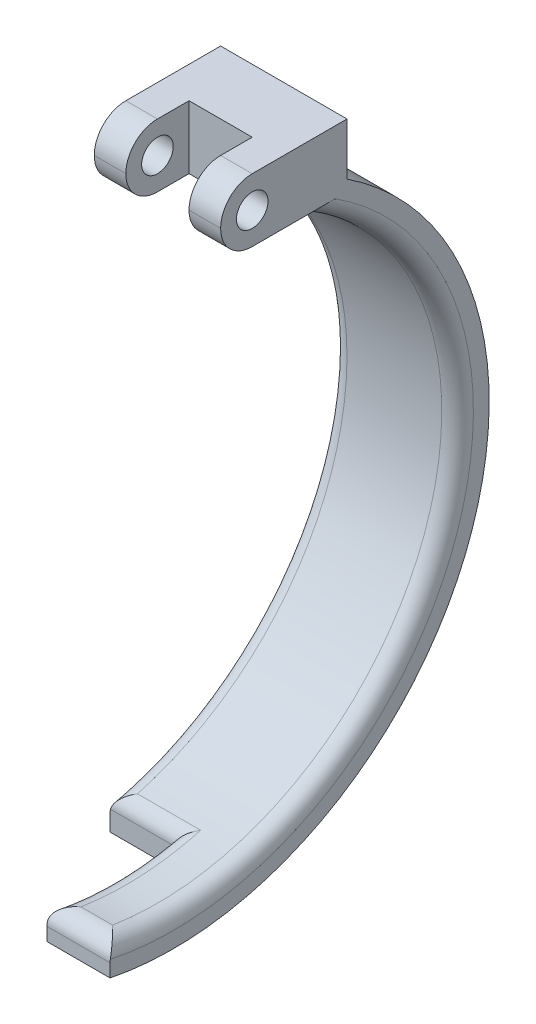
from build123d import *

# Parameters (mm, degrees)
SKETCH3_W               = 20
SKETCH3_H               = 10
BOSS_EXTRUDE2_DEPTH     = 20
CUT_EXTRUDE2_REACH      = 37.444
SKETCH4_W               = 10
SKETCH4_H               = 10
CUT_EXTRUDE3_DEPTH      = 33.882366095
CUT_EXTRUDE3_DEPTH_BACK = 33.882366095
SKETCH5_R               = 2.5
BOSS_EXTRUDE3_DEPTH     = 20
BOSS_EXTRUDE4_START     = -10
BOSS_EXTRUDE4_DEPTH     = 10
CUT_EXTRUDE4_DEPTH      = 10
FILLET1_R               = 5
FILLET2_R               = 2.5


with BuildPart() as part:
    # Sketch3 → Boss-Extrude2 (new body)
    with BuildSketch(Plane(origin=(0, 0, 0), x_dir=(0, 0, -1), z_dir=(1, 0, 0))):
        with Locations((17.5, 5)):
            Rectangle(SKETCH3_W, SKETCH3_H)
    extrude(amount=BOSS_EXTRUDE2_DEPTH)

    # Sketch4 → Cut-Extrude2 (cut, up to next)
    with BuildSketch(Plane(origin=(0, 10, 0), x_dir=(1, 0, 0), z_dir=(0, 1, 0)), mode=Mode.PRIVATE) as cut_extrude2_sk1:
        with Locations((10, 12.5)):
            Rectangle(SKETCH4_W, SKETCH4_H)
    cut_extrude2_tool1 = extrude(cut_extrude2_sk1.sketch, amount=-CUT_EXTRUDE2_REACH, mode=Mode.PRIVATE) & part.part
    add(cut_extrude2_tool1.solids().sort_by_distance((10, 10, -12.5))[0], mode=Mode.SUBTRACT)

    # Sketch5 → Cut-Extrude3 (cut, two sides: drawn at the far end of the back side and taken through both)
    with BuildSketch(Plane(origin=(5, 0, 0), x_dir=(0, 0, -1), z_dir=(1, 0, 0)).offset(-CUT_EXTRUDE3_DEPTH_BACK)):
        with Locations((12.5, 5)):
            Circle(SKETCH5_R)
    extrude(amount=CUT_EXTRUDE3_DEPTH + CUT_EXTRUDE3_DEPTH_BACK, mode=Mode.SUBTRACT)

    # Sketch6 → Boss-Extrude3 (add)
    with BuildSketch(Plane(origin=(0, 0, 0), x_dir=(0, 0, -1), z_dir=(1, 0, 0))):
        with BuildLine():
            Line((0, -85), (0, -90))
            ThreePointArc((0, -90), (47.895258826, -54.354239164), (27.5, 1.758232721))
            Line((27.5, 1.758232721), (20.615528128, 0))
            ThreePointArc((20.615528128, 0), (43.732139211, -50.606601718), (0, -85))
        make_face()
    extrude(amount=BOSS_EXTRUDE3_DEPTH)

    # Sketch7 → Boss-Extrude4 (add)
    with BuildSketch(Plane(origin=(20, 0, 0), x_dir=(0, 0, -1), z_dir=(1, 0, 0)).offset(BOSS_EXTRUDE4_START)):
        with BuildLine():
            Line((0, -85), (0, -90))
            ThreePointArc((0, -90), (-5.0254481, -89.74680765), (-10, -88.989794856))
            Line((-10, -88.989794856), (-10, -83.874821937))
            ThreePointArc((-10, -83.874821937), (-5.031551095, -84.717820761), (0, -85))
        make_face()
    extrude(amount=BOSS_EXTRUDE4_DEPTH)

    # Sketch8 → Cut-Extrude4 (cut)
    with BuildSketch(Plane.ZY):
        with BuildLine():
            Line((0, -85), (0, -90))
            ThreePointArc((0, -90), (-5.0254481, -89.74680765), (-10, -88.989794856))
            Line((-10, -88.989794856), (-10, -83.874821937))
            ThreePointArc((-10, -83.874821937), (-5.031551095, -84.717820761), (0, -85))
        make_face()
    extrude(amount=-CUT_EXTRUDE4_DEPTH, mode=Mode.SUBTRACT)

    # Fillet1
    fillet1_edges = [part.edges().sort_by_distance(p)[0] for p in [
        (17.5, 0, -7.5),
        (17.5, 10, -7.5),
        (2.5, 10, -7.5),
        (2.5, 0, -7.5),
    ]]
    fillet(fillet1_edges, radius=FILLET1_R - 0.0001)  # a hair under: the kernel refuses the full size

    # Fillet2
    fillet2_edges = [part.edges().sort_by_distance(p)[0] for p in [
        (20, -55.429880165, -42.271962317),
        (0, -45.650302702, -44.643858249),
        (10, -85, 0),
        (15, -83.874821937, 10),
        (5, -83.874821937, -10),
    ]]
    fillet(fillet2_edges, radius=FILLET2_R)


solid = part.part
